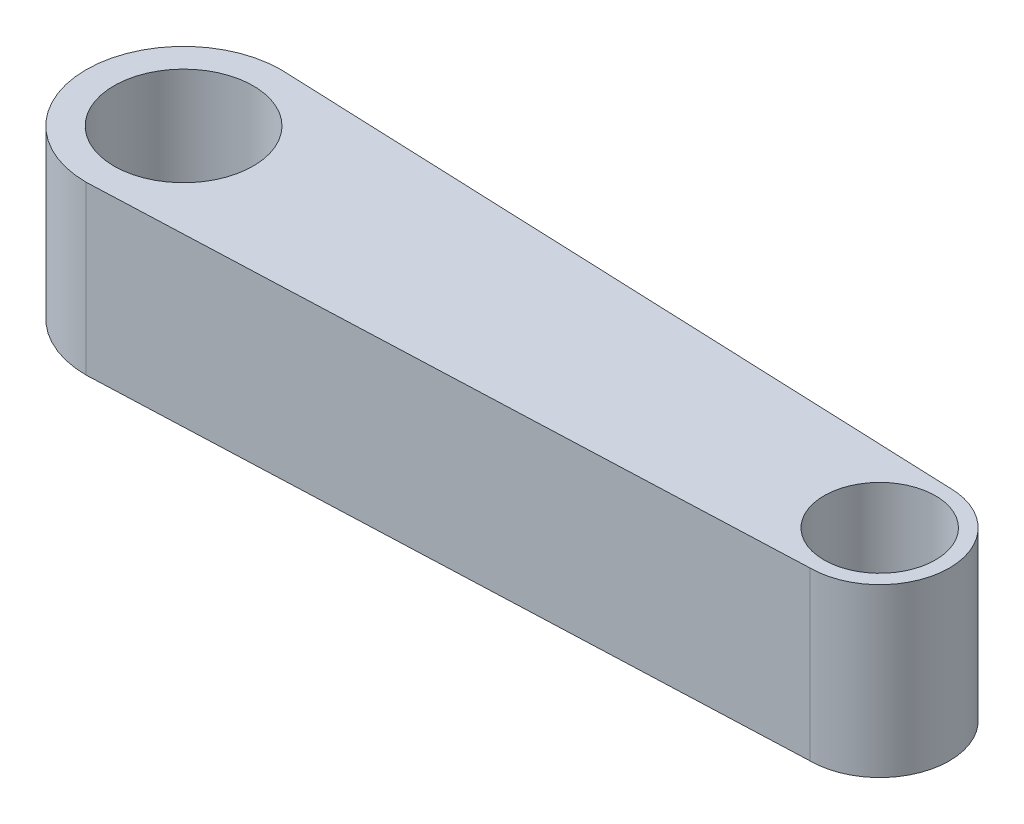
from build123d import *

# Parameters (mm, degrees)
BOSS_EXTRUDE1_DEPTH = 60
SKETCH3_R           = 25
SKETCH3_R_2         = 20
CUT_EXTRUDE1_DEPTH  = 50


with BuildPart() as part:
    # Sketch2 → Boss-Extrude1 (new body)
    with BuildSketch(Plane(origin=(0, 0, 0), x_dir=(1, 0, 0), z_dir=(0, 1, 0))):
        with BuildLine():
            Line((0, 35), (250, 25))
            ThreePointArc((250, 25), (275, 0), (250, -25))
            Line((250, -25), (0, -35))
            ThreePointArc((0, -35), (-35, 0), (0, 35))
        make_face()
    extrude(amount=BOSS_EXTRUDE1_DEPTH)

    # Sketch3 → Cut-Extrude1 (cut)
    with BuildSketch(Plane(origin=(0, 60, 0), x_dir=(1, 0, 0), z_dir=(0, 1, 0))):
        Circle(SKETCH3_R)
        with Locations((250, 0)):
            Circle(SKETCH3_R_2)
    extrude(amount=-CUT_EXTRUDE1_DEPTH, mode=Mode.SUBTRACT)


solid = part.part
